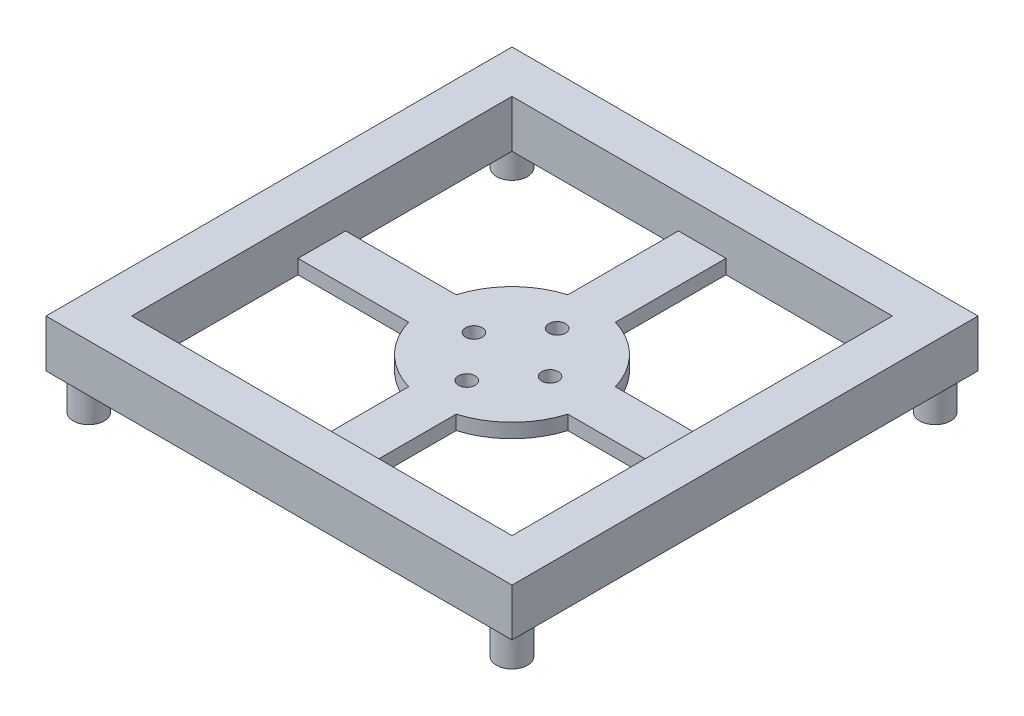
from build123d import *

# Parameters (mm, degrees)
SKETCH2_R                  = 1.75
SKETCH2_W                  = 10
SKETCH2_H                  = 10
BOSS_EXTRUDE1_DEPTH        = 3
CIRPATTERN1_COUNT          = 4
CIRPATTERN2_START          = 40
CIRPATTERN2_OUTLINE_R      = 1.75
CIRPATTERN2_DEPTH          = 3
CIRPATTERN2_START_2        = -43
CIRPATTERN2_2_OUTLINE_R    = 1.75
CIRPATTERN2_2_DEPTH        = 3
CIRPATTERN2_3_OUTLINE_R    = 1.75
CIRPATTERN2_3_DEPTH        = 3
CIRPATTERN2_4_OUTLINE_R    = 1.75
CIRPATTERN2_4_DEPTH        = 3
BOSS_EXTRUDE2_DEPTH        = 50
BOSS_EXTRUDE2_DEPTH_BACK   = 50
SKETCH3_W                  = 10
SKETCH3_H                  = 10
BOSS_EXTRUDE2_2_DEPTH      = 50
BOSS_EXTRUDE2_2_DEPTH_BACK = 50
BOSS_EXTRUDE2_3_DEPTH      = 50
BOSS_EXTRUDE2_3_DEPTH_BACK = 50
BOSS_EXTRUDE2_4_DEPTH      = 50
BOSS_EXTRUDE2_4_DEPTH_BACK = 50
SKETCH4_W                  = 100
SKETCH4_H                  = 100
SKETCH4_W_2                = 80
SKETCH4_H_2                = 80
BOSS_EXTRUDE3_DEPTH        = 10
SKETCH5_W                  = 100
SKETCH5_H                  = 100
SKETCH5_W_2                = 80
SKETCH5_H_2                = 80
BOSS_EXTRUDE4_DEPTH        = 10
SKETCH7_R                  = 3.75
CUT_EXTRUDE2_DEPTH         = 10
SKETCH8_R                  = 3.75
CUT_EXTRUDE3_DEPTH         = 117.828934772
SKETCH9_R                  = 3.75
CUT_EXTRUDE4_DEPTH         = 117.828934772
SKETCH10_W                 = 100
SKETCH10_H                 = 100
CUT_EXTRUDE5_DEPTH         = 3
SKETCH11_W                 = 100
SKETCH11_H                 = 97
CUT_EXTRUDE6_DEPTH         = 1
SKETCH12_W                 = 99
SKETCH12_H                 = 97
CUT_EXTRUDE7_DEPTH         = 1
SKETCH13_W                 = 99
SKETCH13_H                 = 97
CUT_EXTRUDE8_DEPTH         = 1
SKETCH14_W                 = 98
SKETCH14_H                 = 97
CUT_EXTRUDE9_DEPTH         = 1
SKETCH16_W                 = 98
SKETCH16_H                 = 98
CUT_EXTRUDE10_DEPTH        = 112.22499719
SKETCH17_R                 = 3.25
BOSS_EXTRUDE5_DEPTH        = 7.5


# Read off the part's stored shape, not the designer's step: CirPattern2
with BuildPart() as part:
    # Sketch2 → Boss-Extrude1 (new body)
    # profile 1 of 13: a face of its own
    with BuildSketch(Plane.XY.offset(40)):
        with BuildLine():
            ThreePointArc((5, -16.74259435), (0, -17.47325), (-5, -16.74259435))
            Line((-5, -16.74259435), (-5, -50))
            Line((-5, -50), (5, -50))
            Line((5, -50), (5, -16.74259435))
        make_face()
    # profile 2 of 13: a face of its own
    with BuildSketch(Plane.XY.offset(40)):
        with BuildLine():
            Line((5, -5), (-5, -5))
            Line((-5, -5), (-5, -16.74259435))
            ThreePointArc((-5, -16.74259435), (0, -17.47325), (5, -16.74259435))
            Line((5, -16.74259435), (5, -5))
        make_face()
        with Locations((0, -9.5)):
            Circle(SKETCH2_R, mode=Mode.SUBTRACT)
    # profile 3 of 13: a face of its own
    with BuildSketch(Plane.XY.offset(40)):
        with BuildLine():
            Line((16.74259435, -5), (5, -5))
            Line((5, -5), (5, -16.74259435))
            ThreePointArc((5, -16.74259435), (12.355453564, -12.355453564), (16.74259435, -5))
        make_face()
    # profile 4 of 13: a face of its own
    with BuildSketch(Plane.XY.offset(40)):
        with BuildLine():
            Line((5, 5), (5, -5))
            Line((5, -5), (16.74259435, -5))
            ThreePointArc((16.74259435, -5), (17.289621197, -2.526551883), (17.47325, 0))
            ThreePointArc((17.47325, 0), (17.289621197, 2.526551883), (16.74259435, 5))
            Line((16.74259435, 5), (5, 5))
        make_face()
        with Locations((8, 0)):
            Circle(SKETCH2_R, mode=Mode.SUBTRACT)
    # profile 5 of 13: a face of its own
    with BuildSketch(Plane.XY.offset(40)):
        Rectangle(SKETCH2_W, SKETCH2_H)
    # profile 6 of 13: a face of its own
    with BuildSketch(Plane.XY.offset(40)):
        with BuildLine():
            Line((-5, -5), (-16.74259435, -5))
            ThreePointArc((-16.74259435, -5), (-12.355453564, -12.355453564), (-5, -16.74259435))
            Line((-5, -16.74259435), (-5, -5))
        make_face()
    # profile 7 of 13: a face of its own
    with BuildSketch(Plane.XY.offset(40)):
        with BuildLine():
            ThreePointArc((-16.74259435, 5), (-17.47325, 0), (-16.74259435, -5))
            Line((-16.74259435, -5), (-5, -5))
            Line((-5, -5), (-5, 5))
            Line((-5, 5), (-16.74259435, 5))
        make_face()
        with Locations((-8, 0)):
            Circle(SKETCH2_R, mode=Mode.SUBTRACT)
    # profile 8 of 13: a face of its own
    with BuildSketch(Plane.XY.offset(40)):
        with BuildLine():
            ThreePointArc((-5, 16.74259435), (-12.355453564, 12.355453564), (-16.74259435, 5))
            Line((-16.74259435, 5), (-5, 5))
            Line((-5, 5), (-5, 16.74259435))
        make_face()
    # profile 9 of 13: a face of its own
    with BuildSketch(Plane.XY.offset(40)):
        with BuildLine():
            Line((-5, 16.74259435), (-5, 5))
            Line((-5, 5), (5, 5))
            Line((5, 5), (5, 16.74259435))
            ThreePointArc((5, 16.74259435), (0, 17.47325), (-5, 16.74259435))
        make_face()
        with Locations((0, 9.5)):
            Circle(SKETCH2_R, mode=Mode.SUBTRACT)
    # profile 10 of 13: a face of its own
    with BuildSketch(Plane.XY.offset(40)):
        with BuildLine():
            Line((5, 16.74259435), (5, 5))
            Line((5, 5), (16.74259435, 5))
            ThreePointArc((16.74259435, 5), (12.355453564, 12.355453564), (5, 16.74259435))
        make_face()
    # profile 11 of 13: a face of its own
    with BuildSketch(Plane.XY.offset(40)):
        with BuildLine():
            ThreePointArc((17.47325, 0), (17.289621197, -2.526551883), (16.74259435, -5))
            Line((16.74259435, -5), (50, -5))
            Line((50, -5), (50, 5))
            Line((50, 5), (16.74259435, 5))
            ThreePointArc((16.74259435, 5), (17.289621197, 2.526551883), (17.47325, 0))
        make_face()
    # profile 12 of 13: a face of its own
    with BuildSketch(Plane.XY.offset(40)):
        with BuildLine():
            Line((-50, 5), (-50, -5))
            Line((-50, -5), (-16.74259435, -5))
            ThreePointArc((-16.74259435, -5), (-17.47325, 0), (-16.74259435, 5))
            Line((-16.74259435, 5), (-50, 5))
        make_face()
    # profile 13 of 13: a face of its own
    with BuildSketch(Plane.XY.offset(40)):
        with BuildLine():
            Line((-5, 50), (-5, 16.74259435))
            ThreePointArc((-5, 16.74259435), (0, 17.47325), (5, 16.74259435))
            Line((5, 16.74259435), (5, 50))
            Line((5, 50), (-5, 50))
        make_face()
    extrude(amount=BOSS_EXTRUDE1_DEPTH)


with BuildPart() as cirpattern1_1:
    # CirPattern1: pattern copy
    add(part.part.rotate(Axis((0, 0, 0), (1, 0, 0)), 1 * 360 / CIRPATTERN1_COUNT))


with BuildPart() as cirpattern1_2:
    # CirPattern1: pattern copy
    add(part.part.rotate(Axis((0, 0, 0), (1, 0, 0)), 2 * 360 / CIRPATTERN1_COUNT))


with BuildPart() as cirpattern1_3:
    # CirPattern1: pattern copy
    add(part.part.rotate(Axis((0, 0, 0), (1, 0, 0)), 3 * 360 / CIRPATTERN1_COUNT))


with BuildPart() as body_5:
    # CirPattern2 outline → CirPattern2 (new body)
    with BuildSketch(Plane.XY.offset(CIRPATTERN2_START)):
        with BuildLine():
            ThreePointArc((5, -16.74259435), (12.355453564, -12.355453564), (16.74259435, -5))
            Line((16.74259435, -5), (50, -5))
            Line((50, -5), (50, 5))
            Line((50, 5), (16.74259435, 5))
            ThreePointArc((16.74259435, 5), (12.355453564, 12.355453564), (5, 16.74259435))
            Line((5, 16.74259435), (5, 50))
            Line((5, 50), (-5, 50))
            Line((-5, 50), (-5, 16.74259435))
            ThreePointArc((-5, 16.74259435), (-12.355453564, 12.355453564), (-16.74259435, 5))
            Line((-16.74259435, 5), (-50, 5))
            Line((-50, 5), (-50, -5))
            Line((-50, -5), (-16.74259435, -5))
            ThreePointArc((-16.74259435, -5), (-12.355453564, -12.355453564), (-5, -16.74259435))
            Line((-5, -16.74259435), (-5, -50))
            Line((-5, -50), (5, -50))
            Line((5, -50), (5, -16.74259435))
        make_face()
        with Locations((0, -9.5)):
            Circle(CIRPATTERN2_OUTLINE_R, mode=Mode.SUBTRACT)
        with Locations((-8, 0)):
            Circle(CIRPATTERN2_OUTLINE_R, mode=Mode.SUBTRACT)
        with Locations((8, 0)):
            Circle(CIRPATTERN2_OUTLINE_R, mode=Mode.SUBTRACT)
        with Locations((0, 9.5)):
            Circle(CIRPATTERN2_OUTLINE_R, mode=Mode.SUBTRACT)
    extrude(amount=CIRPATTERN2_DEPTH)


with BuildPart() as body_6:
    # CirPattern2 2 outline → CirPattern2 2 (new body)
    with BuildSketch(Plane.YZ.offset(CIRPATTERN2_START_2)):
        with BuildLine():
            Line((-5, 50), (-5, 16.74259435))
            ThreePointArc((-5, 16.74259435), (-12.355453564, 12.355453564), (-16.74259435, 5))
            Line((-16.74259435, 5), (-50, 5))
            Line((-50, 5), (-50, -5))
            Line((-50, -5), (-16.74259435, -5))
            ThreePointArc((-16.74259435, -5), (-12.355453564, -12.355453564), (-5, -16.74259435))
            Line((-5, -16.74259435), (-5, -50))
            Line((-5, -50), (5, -50))
            Line((5, -50), (5, -16.74259435))
            ThreePointArc((5, -16.74259435), (12.355453564, -12.355453564), (16.74259435, -5))
            Line((16.74259435, -5), (50, -5))
            Line((50, -5), (50, 5))
            Line((50, 5), (16.74259435, 5))
            ThreePointArc((16.74259435, 5), (12.355453564, 12.355453564), (5, 16.74259435))
            Line((5, 16.74259435), (5, 50))
            Line((5, 50), (-5, 50))
        make_face()
        with Locations((0, -8)):
            Circle(CIRPATTERN2_2_OUTLINE_R, mode=Mode.SUBTRACT)
        with Locations((-9.5, 0)):
            Circle(CIRPATTERN2_2_OUTLINE_R, mode=Mode.SUBTRACT)
        with Locations((9.5, 0)):
            Circle(CIRPATTERN2_2_OUTLINE_R, mode=Mode.SUBTRACT)
        with Locations((0, 8)):
            Circle(CIRPATTERN2_2_OUTLINE_R, mode=Mode.SUBTRACT)
    extrude(amount=CIRPATTERN2_2_DEPTH)


with BuildPart() as body_7:
    # CirPattern2 3 outline → CirPattern2 3 (new body)
    with BuildSketch(Plane.YZ.offset(CIRPATTERN2_START)):
        with BuildLine():
            ThreePointArc((-16.74259435, -5), (-12.355453564, -12.355453564), (-5, -16.74259435))
            Line((-5, -16.74259435), (-5, -50))
            Line((-5, -50), (5, -50))
            Line((5, -50), (5, -16.74259435))
            ThreePointArc((5, -16.74259435), (12.355453564, -12.355453564), (16.74259435, -5))
            Line((16.74259435, -5), (50, -5))
            Line((50, -5), (50, 5))
            Line((50, 5), (16.74259435, 5))
            ThreePointArc((16.74259435, 5), (12.355453564, 12.355453564), (5, 16.74259435))
            Line((5, 16.74259435), (5, 50))
            Line((5, 50), (-5, 50))
            Line((-5, 50), (-5, 16.74259435))
            ThreePointArc((-5, 16.74259435), (-12.355453564, 12.355453564), (-16.74259435, 5))
            Line((-16.74259435, 5), (-50, 5))
            Line((-50, 5), (-50, -5))
            Line((-50, -5), (-16.74259435, -5))
        make_face()
        with Locations((0, -8)):
            Circle(CIRPATTERN2_3_OUTLINE_R, mode=Mode.SUBTRACT)
        with Locations((-9.5, 0)):
            Circle(CIRPATTERN2_3_OUTLINE_R, mode=Mode.SUBTRACT)
        with Locations((9.5, 0)):
            Circle(CIRPATTERN2_3_OUTLINE_R, mode=Mode.SUBTRACT)
        with Locations((0, 8)):
            Circle(CIRPATTERN2_3_OUTLINE_R, mode=Mode.SUBTRACT)
    extrude(amount=CIRPATTERN2_3_DEPTH)


with BuildPart() as body_8:
    # CirPattern2 4 outline → CirPattern2 4 (new body)
    with BuildSketch(Plane.XY.offset(CIRPATTERN2_START_2)):
        with BuildLine():
            Line((50, 5), (16.74259435, 5))
            ThreePointArc((16.74259435, 5), (12.355453564, 12.355453564), (5, 16.74259435))
            Line((5, 16.74259435), (5, 50))
            Line((5, 50), (-5, 50))
            Line((-5, 50), (-5, 16.74259435))
            ThreePointArc((-5, 16.74259435), (-12.355453564, 12.355453564), (-16.74259435, 5))
            Line((-16.74259435, 5), (-50, 5))
            Line((-50, 5), (-50, -5))
            Line((-50, -5), (-16.74259435, -5))
            ThreePointArc((-16.74259435, -5), (-12.355453564, -12.355453564), (-5, -16.74259435))
            Line((-5, -16.74259435), (-5, -50))
            Line((-5, -50), (5, -50))
            Line((5, -50), (5, -16.74259435))
            ThreePointArc((5, -16.74259435), (12.355453564, -12.355453564), (16.74259435, -5))
            Line((16.74259435, -5), (50, -5))
            Line((50, -5), (50, 5))
        make_face()
        with Locations((0, -9.5)):
            Circle(CIRPATTERN2_4_OUTLINE_R, mode=Mode.SUBTRACT)
        with Locations((-8, 0)):
            Circle(CIRPATTERN2_4_OUTLINE_R, mode=Mode.SUBTRACT)
        with Locations((8, 0)):
            Circle(CIRPATTERN2_4_OUTLINE_R, mode=Mode.SUBTRACT)
        with Locations((0, 9.5)):
            Circle(CIRPATTERN2_4_OUTLINE_R, mode=Mode.SUBTRACT)
    extrude(amount=CIRPATTERN2_4_DEPTH)


with BuildPart() as body_9:
    # Sketch3 → Boss-Extrude2 (new, two sides: drawn at the far end of the back side and taken through both)
    with BuildSketch(Plane(origin=(0, 0, 0), x_dir=(1, 0, 0), z_dir=(0, 1, 0)).offset(-BOSS_EXTRUDE2_DEPTH_BACK)):
        with Locations((-45, -45)):
            Rectangle(SKETCH3_W, SKETCH3_H)
    extrude(amount=BOSS_EXTRUDE2_DEPTH + BOSS_EXTRUDE2_DEPTH_BACK)


with BuildPart() as body_10:
    # Sketch3 → Boss-Extrude2 2 (new, two sides: drawn at the far end of the back side and taken through both)
    with BuildSketch(Plane(origin=(0, 0, 0), x_dir=(1, 0, 0), z_dir=(0, 1, 0)).offset(-BOSS_EXTRUDE2_2_DEPTH_BACK)):
        with Locations((45, -45)):
            Rectangle(SKETCH3_W, SKETCH3_H)
    extrude(amount=BOSS_EXTRUDE2_2_DEPTH + BOSS_EXTRUDE2_2_DEPTH_BACK)


with BuildPart() as body_11:
    # Sketch3 → Boss-Extrude2 3 (new, two sides: drawn at the far end of the back side and taken through both)
    with BuildSketch(Plane(origin=(0, 0, 0), x_dir=(1, 0, 0), z_dir=(0, 1, 0)).offset(-BOSS_EXTRUDE2_3_DEPTH_BACK)):
        with Locations((45, 45)):
            Rectangle(SKETCH3_W, SKETCH3_H)
    extrude(amount=BOSS_EXTRUDE2_3_DEPTH + BOSS_EXTRUDE2_3_DEPTH_BACK)


with BuildPart() as body_12:
    # Sketch3 → Boss-Extrude2 4 (new, two sides: drawn at the far end of the back side and taken through both)
    with BuildSketch(Plane(origin=(0, 0, 0), x_dir=(1, 0, 0), z_dir=(0, 1, 0)).offset(-BOSS_EXTRUDE2_4_DEPTH_BACK)):
        with Locations((-45, 45)):
            Rectangle(SKETCH3_W, SKETCH3_H)
    extrude(amount=BOSS_EXTRUDE2_4_DEPTH + BOSS_EXTRUDE2_4_DEPTH_BACK)


with BuildPart() as part_1:
    add(part.part)

    add(cirpattern1_1.part)  # Boss-Extrude3 merges CirPattern1_1

    add(cirpattern1_2.part)  # Boss-Extrude3 merges CirPattern1_2

    add(body_5.part)  # Boss-Extrude3 merges body 5

    add(body_6.part)  # Boss-Extrude3 merges body 6

    add(body_7.part)  # Boss-Extrude3 merges body 7

    add(body_8.part)  # Boss-Extrude3 merges body 8

    add(body_9.part)  # Boss-Extrude3 merges body 9

    add(body_10.part)  # Boss-Extrude3 merges body 10

    add(body_11.part)  # Boss-Extrude3 merges body 11

    add(body_12.part)  # Boss-Extrude3 merges body 12
    # Sketch4 → Boss-Extrude3 (add)
    with BuildSketch(Plane.XZ.offset(50)):
        Rectangle(SKETCH4_W, SKETCH4_H)
        Rectangle(SKETCH4_W_2, SKETCH4_H_2, mode=Mode.SUBTRACT)
    extrude(amount=-BOSS_EXTRUDE3_DEPTH)

    add(cirpattern1_3.part)  # Boss-Extrude4 merges CirPattern1_3
    # Sketch5 → Boss-Extrude4 (add)
    with BuildSketch(Plane(origin=(0, 50, 0), x_dir=(1, 0, 0), z_dir=(0, 1, 0))):
        Rectangle(SKETCH5_W, SKETCH5_H)
        Rectangle(SKETCH5_W_2, SKETCH5_H_2, mode=Mode.SUBTRACT)
    extrude(amount=-BOSS_EXTRUDE4_DEPTH)

    # Sketch7 → Cut-Extrude2 (cut)
    with BuildSketch(Plane.XZ.offset(43)):
        with Locations(Location((0, 0, 0), (0, 0, 270))):
            Circle(SKETCH7_R)
    extrude(amount=-CUT_EXTRUDE2_DEPTH, mode=Mode.SUBTRACT)

    # Sketch8 → Cut-Extrude3 (cut, through all)
    with BuildSketch(Plane.ZY.offset(43)):
        Circle(SKETCH8_R)
    extrude(amount=-CUT_EXTRUDE3_DEPTH, mode=Mode.SUBTRACT)

    # Sketch9 → Cut-Extrude4 (cut, through all)
    with BuildSketch(Plane(origin=(0, 0, -43), x_dir=(-1, 0, 0), z_dir=(0, 0, -1))):
        Circle(SKETCH9_R)
    extrude(amount=-CUT_EXTRUDE4_DEPTH, mode=Mode.SUBTRACT)

    # Sketch10 → Cut-Extrude5 (cut)
    with BuildSketch(Plane.XZ.offset(50)):
        Rectangle(SKETCH10_W, SKETCH10_H)
    extrude(amount=-CUT_EXTRUDE5_DEPTH, mode=Mode.SUBTRACT)

    # Sketch11 → Cut-Extrude6 (cut)
    with BuildSketch(Plane.ZY.offset(50)):
        with Locations((0, 1.5)):
            Rectangle(SKETCH11_W, SKETCH11_H)
    extrude(amount=-CUT_EXTRUDE6_DEPTH, mode=Mode.SUBTRACT)

    # Sketch12 → Cut-Extrude7 (cut)
    with BuildSketch(Plane.XY.offset(50)):
        with Locations((0.5, 1.5)):
            Rectangle(SKETCH12_W, SKETCH12_H)
    extrude(amount=-CUT_EXTRUDE7_DEPTH, mode=Mode.SUBTRACT)

    # Sketch13 → Cut-Extrude8 (cut)
    with BuildSketch(Plane(origin=(50, 0, 0), x_dir=(0, 0, -1), z_dir=(1, 0, 0))):
        with Locations((0.5, 1.5)):
            Rectangle(SKETCH13_W, SKETCH13_H)
    extrude(amount=-CUT_EXTRUDE8_DEPTH, mode=Mode.SUBTRACT)

    # Sketch14 → Cut-Extrude9 (cut)
    with BuildSketch(Plane(origin=(0, 0, -50), x_dir=(-1, 0, 0), z_dir=(0, 0, -1))):
        with Locations((0, 1.5)):
            Rectangle(SKETCH14_W, SKETCH14_H)
    extrude(amount=-CUT_EXTRUDE9_DEPTH, mode=Mode.SUBTRACT)

    # Sketch16 → Cut-Extrude10 (cut, through all)
    with BuildSketch(Plane.XZ.offset(-40)):
        Rectangle(SKETCH16_W, SKETCH16_H)
    extrude(amount=CUT_EXTRUDE10_DEPTH, mode=Mode.SUBTRACT)

    # Sketch17 → Boss-Extrude5 (add)
    with BuildSketch(Plane.XZ.offset(-40)):
        with Locations(Location((44.5, -44.5, 0), (0, 0, 90))):
            Circle(SKETCH17_R)
        with Locations(Location((-44.5, -44.5, 0), (0, 0, 90))):
            Circle(SKETCH17_R)
        with Locations(Location((-44.5, 44.5, 0), (0, 0, 90))):
            Circle(SKETCH17_R)
        with Locations(Location((44.5, 44.5, 0), (0, 0, 90))):
            Circle(SKETCH17_R)
    extrude(amount=BOSS_EXTRUDE5_DEPTH)


solid = part_1.part
